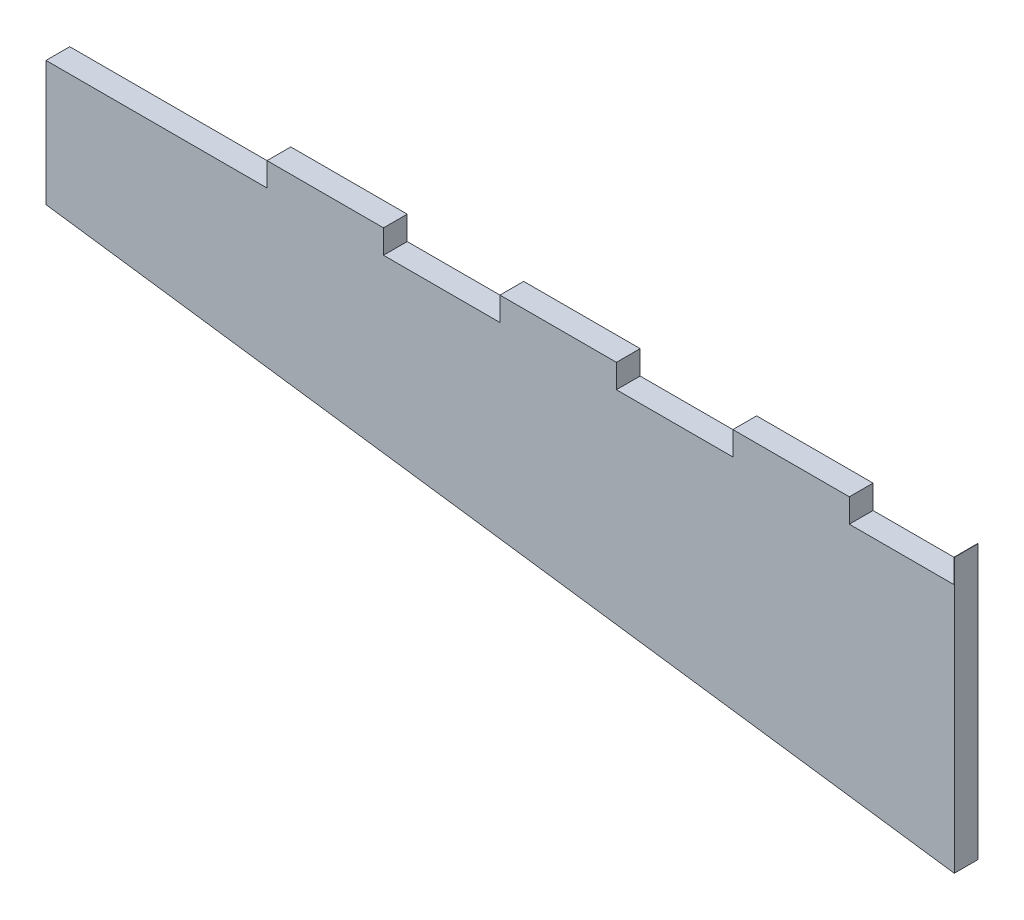
from build123d import *

# Parameters (mm, degrees)
SKETCH1_W           = 184.658
SKETCH1_H           = 30.226
BOSS_EXTRUDE1_DEPTH = 4.826
SKETCH2_W           = 44.940352886
SKETCH2_H           = 4.826
SKETCH2_W_2         = 23.676676443
SKETCH2_W_3         = 21.263676443
CUT_EXTRUDE1_DEPTH  = 188.17766511
BOSS_EXTRUDE3_DEPTH = 4.826


with BuildPart() as part:
    # Sketch1 → Boss-Extrude1 (new body)
    with BuildSketch(Plane.XY):
        with Locations((92.329, 15.113)):
            Rectangle(SKETCH1_W, SKETCH1_H)
    extrude(amount=BOSS_EXTRUDE1_DEPTH)

    # Sketch2 → Cut-Extrude1 (cut, through all)
    with BuildSketch(Plane(origin=(0, 0, 0), x_dir=(-1, 0, 0), z_dir=(0, 0, -1))):
        with Locations((-22.470176443, 27.813)):
            Rectangle(SKETCH2_W, SKETCH2_H)
        with Locations((-80.45536755, 27.813)):
            Rectangle(SKETCH2_W_2, SKETCH2_H)
        with Locations((-127.808720436, 27.813)):
            Rectangle(SKETCH2_W_2, SKETCH2_H)
        with Locations((-173.955573322, 27.813)):
            Rectangle(SKETCH2_W_3, SKETCH2_H)
    extrude(amount=-CUT_EXTRUDE1_DEPTH, mode=Mode.SUBTRACT)

    # Sketch3 → Boss-Extrude3 (add)
    with BuildSketch(Plane.XY.offset(4.826)):
        Polygon((184.658, 0), (184.658, -25.4), (0, 0), align=None)
    extrude(amount=-BOSS_EXTRUDE3_DEPTH)


solid = part.part
